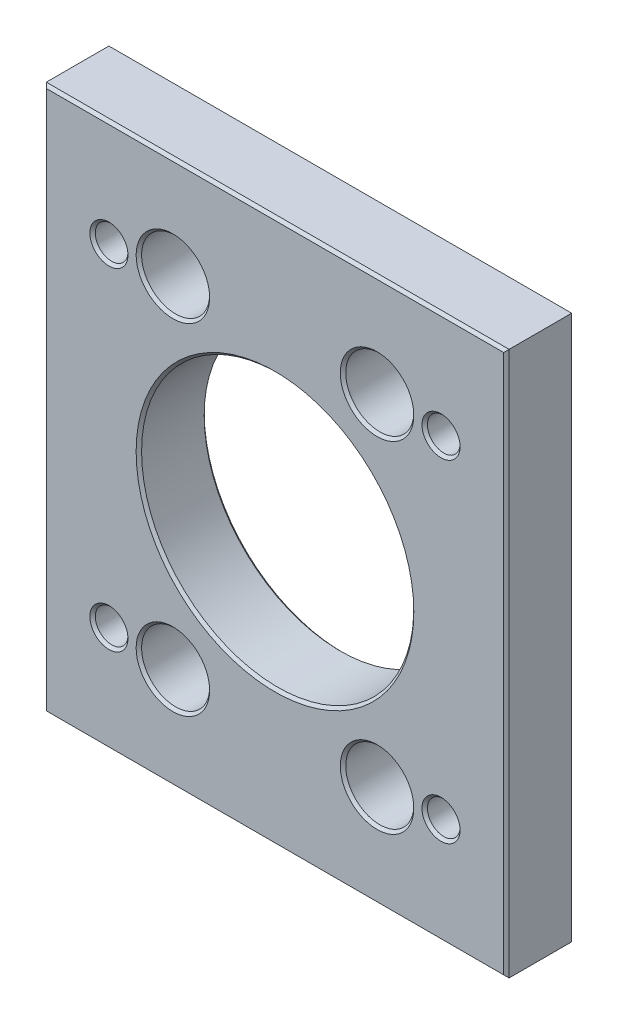
from build123d import *

# Parameters (mm, degrees)
SKETCH1_W           = 43.18
SKETCH1_H           = 50.8
SKETCH1_R           = 1.524
SKETCH1_R_2         = 3.175
SKETCH1_R_3         = 12.7
BOSS_EXTRUDE1_DEPTH = 6.35
CHAMFER1_SIZE       = 0.254


with BuildPart() as part:
    # Sketch1 → Boss-Extrude1 (new body)
    with BuildSketch(Plane.XY):
        Rectangle(SKETCH1_W, SKETCH1_H)
        with Locations((-15.494, 15.494)):
            Circle(SKETCH1_R, mode=Mode.SUBTRACT)
        with Locations((-9.525, 15.875)):
            Circle(SKETCH1_R_2, mode=Mode.SUBTRACT)
        with Locations((-15.494, -15.494)):
            Circle(SKETCH1_R, mode=Mode.SUBTRACT)
        with Locations((-9.525, -15.875)):
            Circle(SKETCH1_R_2, mode=Mode.SUBTRACT)
        with Locations((9.525, -15.875)):
            Circle(SKETCH1_R_2, mode=Mode.SUBTRACT)
        with Locations((15.494, -15.494)):
            Circle(SKETCH1_R, mode=Mode.SUBTRACT)
        with Locations((9.525, 15.875)):
            Circle(SKETCH1_R_2, mode=Mode.SUBTRACT)
        with Locations((15.494, 15.494)):
            Circle(SKETCH1_R, mode=Mode.SUBTRACT)
        Circle(SKETCH1_R_3, mode=Mode.SUBTRACT)
    extrude(amount=BOSS_EXTRUDE1_DEPTH)

    # Chamfer1
    chamfer1_edges = [part.edges().sort_by_distance(p)[0] for p in [
        (13.97, 15.494, 0),
        (13.97, -15.494, 0),
        (-12.7, -15.875, 0),
        (-12.7, 15.875, 0),
        (0, 25.4, 0),
        (-21.59, 0, 0),
        (0, -25.4, 0),
        (21.59, 0, 0),
        (-17.018, 15.494, 0),
        (-17.018, -15.494, 0),
        (6.35, -15.875, 0),
        (6.35, 15.875, 0),
        (13.97, 15.494, 6.35),
        (6.35, 15.875, 6.35),
        (13.97, -15.494, 6.35),
        (6.35, -15.875, 6.35),
        (-12.7, -15.875, 6.35),
        (-17.018, -15.494, 6.35),
        (-12.7, 15.875, 6.35),
        (-17.018, 15.494, 6.35),
        (0, -25.4, 6.35),
        (-21.59, 0, 6.35),
        (0, 25.4, 6.35),
        (21.59, 0, 6.35),
        (-12.7, 0, 0),
        (-12.7, 0, 6.35),
    ]]
    chamfer(chamfer1_edges, length=CHAMFER1_SIZE)


solid = part.part
